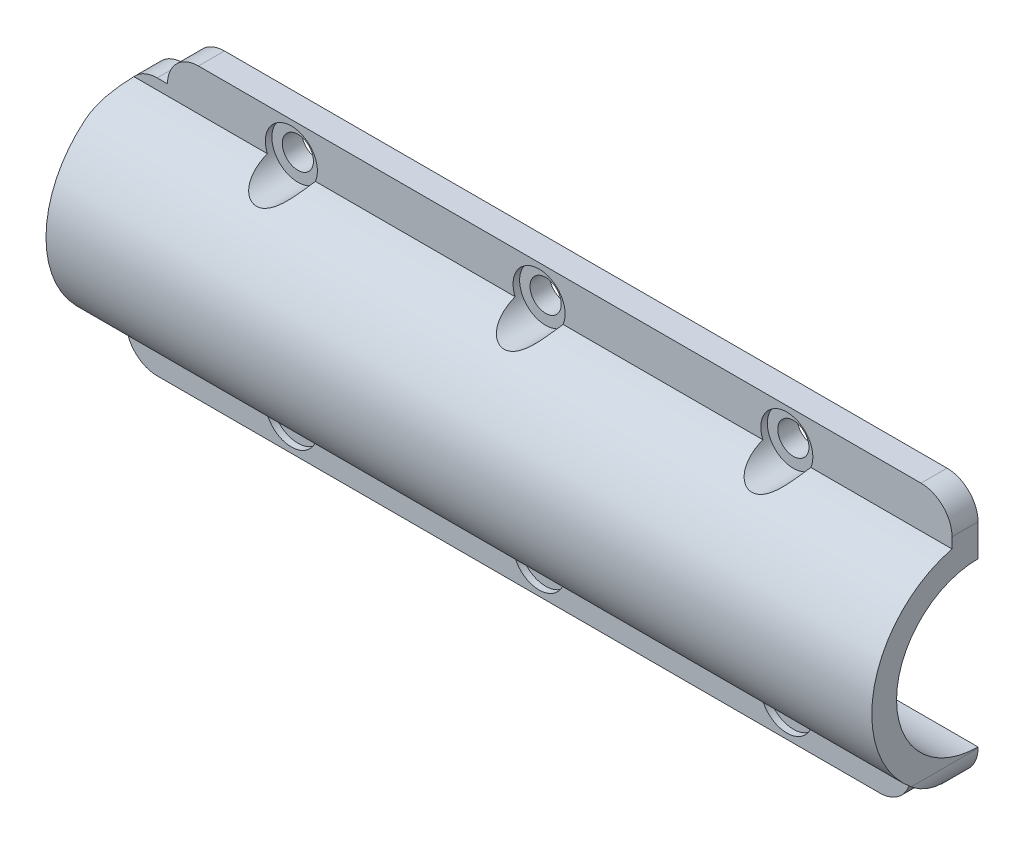
from build123d import *

# Parameters (mm, degrees)
BOSS_EXTRUDE1_DEPTH  = 114.3
CUT_EXTRUDE1_START   = -1
SKETCH2_R            = 4
CUT_EXTRUDE1_DEPTH   = 7.35
M4_CLEARANCE_HOLE1_D = 4.8
FILLET1_R            = 4.7625
BOSS_EXTRUDE2_START  = 6.35
BOSS_EXTRUDE2_DEPTH  = 6.35
BOSS_EXTRUDE3_DEPTH  = 6.35
FILLET2_R            = 4.7625


with BuildPart() as part:
    # Sketch1 → Boss-Extrude1 (new body)
    with BuildSketch(Plane(origin=(0, 0, 0), x_dir=(0, 0, -1), z_dir=(1, 0, 0))):
        with BuildLine():
            Line((0, 22.225), (-4, 22.225))
            Line((-4, 22.225), (-4, 15.839643355))
            ThreePointArc((-3.999999999, 15.839643349), (-16.336899991, 0), (-3.999999999, -15.839643349))
            Line((-4, -15.839643355), (-4, -22.225))
            Line((-4, -22.225), (0, -22.225))
            Line((0, -22.225), (0, -12.5269))
            ThreePointArc((0, -12.5269), (-12.5269, 0), (0, 12.5269))
            Line((0, 12.5269), (0, 22.225))
        make_face()
    extrude(amount=BOSS_EXTRUDE1_DEPTH)

    # Sketch2 → Cut-Extrude1 (cut)
    with BuildSketch(Plane.XY.offset(4).offset(CUT_EXTRUDE1_START)):
        with Locations((19.05, -17.37595)):
            Circle(SKETCH2_R)
        with Locations((57.15, -17.37595)):
            Circle(SKETCH2_R)
        with Locations((95.25, -17.37595)):
            Circle(SKETCH2_R)
    cut_extrude1 = extrude(amount=CUT_EXTRUDE1_DEPTH, mode=Mode.SUBTRACT)

    # M4 Clearance Hole1 (through all)
    with Locations(Plane.XY.offset(4)):
        with Locations((19.05, -17.37595), (57.15, -17.37595), (95.25, -17.37595)):
            m4_clearance_hole1 = Hole(M4_CLEARANCE_HOLE1_D / 2)

    # Mirror1: Cut-Extrude1, M4 Clearance Hole1 across plane
    add(cut_extrude1.mirror(Plane.ZX), mode=Mode.SUBTRACT)
    add(m4_clearance_hole1.mirror(Plane.ZX), mode=Mode.SUBTRACT)

    # Fillet1
    fillet1_edges = [part.edges().sort_by_distance(p)[0] for p in [
        (114.3, -22.225, 2),
        (0, 22.225, 2),
    ]]
    fillet(fillet1_edges, radius=FILLET1_R)

    # Sketch8 → Boss-Extrude2 (add)
    with BuildSketch(Plane.ZY.offset(BOSS_EXTRUDE2_START)):
        with BuildLine():
            Line((3.999999999, 15.839643352), (4, 17.4625))
            Line((4, 17.4625), (0, 17.4625))
            Line((0, 17.4625), (0, 12.5269))
            ThreePointArc((0, 12.5269), (12.5269, 0), (0, -12.5269))
            Line((0, -12.5269), (0, -22.225))
            Line((0, -22.225), (4, -22.225))
            Line((4, -22.225), (3.999999999, -15.839643352))
            ThreePointArc((3.999999999, -15.839643352), (16.336899994, 0), (3.999999999, 15.839643352))
        make_face()
    extrude(amount=-BOSS_EXTRUDE2_DEPTH)

    # Sketch9 → Boss-Extrude3 (add)
    with BuildSketch(Plane(origin=(114.3, 0, 0), x_dir=(0, 0, -1), z_dir=(1, 0, 0))):
        with BuildLine():
            Line((-3.999999999, -15.839643352), (-4, -17.4625))
            Line((-4, -17.4625), (0, -17.4625))
            Line((0, -17.4625), (0, -12.5269))
            ThreePointArc((0, -12.5269), (-12.5269, 0), (0, 12.5269))
            Line((0, 12.5269), (0, 22.225))
            Line((0, 22.225), (-4, 22.225))
            Line((-4, 22.225), (-3.999999999, 15.839643352))
            ThreePointArc((-3.999999999, 15.839643352), (-16.336899994, 0), (-3.999999999, -15.839643352))
        make_face()
    extrude(amount=BOSS_EXTRUDE3_DEPTH)

    # Fillet2
    fillet2_edges = [part.edges().sort_by_distance(p)[0] for p in [
        (120.65, -17.4625, 2),
        (120.65, 22.225, 2),
        (-6.35, 17.4625, 2),
        (-6.35, -22.225, 2),
    ]]
    fillet(fillet2_edges, radius=FILLET2_R)


solid = part.part
